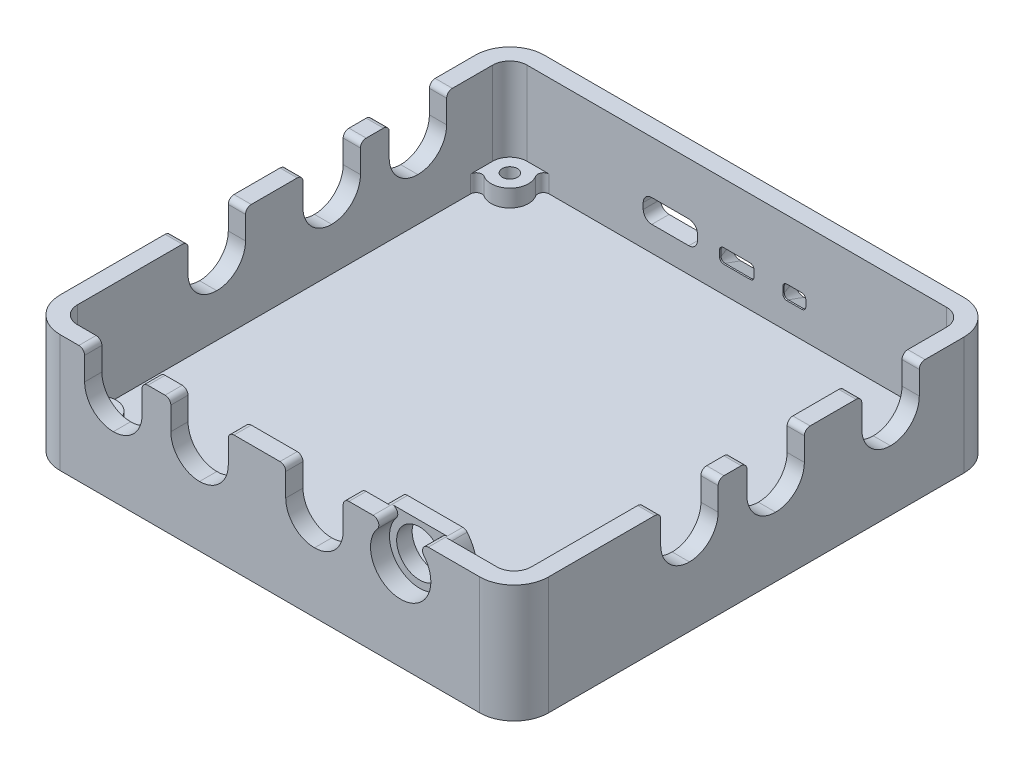
from build123d import *

# Parameters (mm, degrees)
SKETCH1_W           = 85
SKETCH1_H           = 84.25
BOSS_EXTRUDE1_DEPTH = 3
BOSS_EXTRUDE2_START = 3
SKETCH1_3_R         = 1.325
BOSS_EXTRUDE2_DEPTH = 3
BOSS_EXTRUDE6_START = 3
SKETCH1_5_W         = 85
SKETCH1_5_H         = 84.25
SKETCH1_5_W_2       = 79
SKETCH1_5_H_2       = 78.25
BOSS_EXTRUDE6_DEPTH = 17.5
FILLET1_R           = 3
FILLET2_R           = 6
FILLET3_START       = 2
FILLET3_DEPTH       = 4
SKETCH2_W           = 3
SKETCH2_H           = 10
SKETCH2_W_2         = 10
SKETCH2_H_2         = 3
CUT_EXTRUDE1_DEPTH  = 10
FILLET4_R           = 5
FILLET5_R           = 1
CUT_EXTRUDE2_REACH  = 98.564
SKETCH4_W           = 9.43
SKETCH4_H           = 4.04
FILLET6_R           = 1.5
CUT_EXTRUDE3_REACH  = 98.564
SKETCH5_W           = 6
SKETCH5_H           = 2.5
SKETCH5_W_2         = 4
FILLET7_R           = 0.7
CHAMFER1_SIZE       = 1
CHAMFER1_SIZE2      = 2.747477419
SKETCH6_R           = 4
BOSS_EXTRUDE7_DEPTH = 6
SKETCH6_4_R         = 4
CUT_EXTRUDE4_DEPTH  = 3.3
FILLET8_R           = 1


with BuildPart() as part:
    # Sketch1 → Boss-Extrude1 (new body)
    with BuildSketch(Plane(origin=(0, 0, 0), x_dir=(1, 0, 0), z_dir=(0, 1, 0))):
        Rectangle(SKETCH1_W, SKETCH1_H)
    extrude(amount=BOSS_EXTRUDE1_DEPTH)

    # Sketch1<3> → Boss-Extrude2 (add)
    # profile 1 of 4: a face of its own
    with BuildSketch(Plane(origin=(0, 0, 0), x_dir=(1, 0, 0), z_dir=(0, 1, 0)).offset(BOSS_EXTRUDE2_START)):
        with BuildLine():
            Line((36.25, -39.125), (39.5, -39.125))
            Line((39.5, -39.125), (39.5, -35.875))
            ThreePointArc((39.5, -35.875), (33.951902961, -33.576902961), (36.25, -39.125))
        make_face()
        with Locations(Location((36.25, -35.875, 0), (0, 0, 270))):
            Circle(SKETCH1_3_R, mode=Mode.SUBTRACT)
    # profile 2 of 4: a face of its own
    with BuildSketch(Plane(origin=(0, 0, 0), x_dir=(1, 0, 0), z_dir=(0, 1, 0)).offset(BOSS_EXTRUDE2_START)):
        with BuildLine():
            Line((-39.5, -39.125), (-36.25, -39.125))
            ThreePointArc((-36.25, -39.125), (-33.951902961, -33.576902961), (-39.5, -35.875))
            Line((-39.5, -35.875), (-39.5, -39.125))
        make_face()
        with Locations(Location((-36.25, -35.875, 0), (0, 0, 270))):
            Circle(SKETCH1_3_R, mode=Mode.SUBTRACT)
    # profile 3 of 4: a face of its own
    with BuildSketch(Plane(origin=(0, 0, 0), x_dir=(1, 0, 0), z_dir=(0, 1, 0)).offset(BOSS_EXTRUDE2_START)):
        with BuildLine():
            Line((39.5, 39.125), (36.25, 39.125))
            ThreePointArc((36.25, 39.125), (33.951902961, 33.576902961), (39.5, 35.875))
            Line((39.5, 35.875), (39.5, 39.125))
        make_face()
        with Locations(Location((36.25, 35.875, 0), (0, 0, 270))):
            Circle(SKETCH1_3_R, mode=Mode.SUBTRACT)
    # profile 4 of 4: a face of its own
    with BuildSketch(Plane(origin=(0, 0, 0), x_dir=(1, 0, 0), z_dir=(0, 1, 0)).offset(BOSS_EXTRUDE2_START)):
        with BuildLine():
            Line((-39.5, 39.125), (-39.5, 35.875))
            ThreePointArc((-39.5, 35.875), (-33.951902961, 33.576902961), (-36.25, 39.125))
            Line((-36.25, 39.125), (-39.5, 39.125))
        make_face()
        with Locations(Location((-36.25, 35.875, 0), (0, 0, 270))):
            Circle(SKETCH1_3_R, mode=Mode.SUBTRACT)
    extrude(amount=BOSS_EXTRUDE2_DEPTH)

    # Sketch1<5> → Boss-Extrude6 (add)
    with BuildSketch(Plane(origin=(0, 0, 0), x_dir=(1, 0, 0), z_dir=(0, 1, 0)).offset(BOSS_EXTRUDE6_START)):
        Rectangle(SKETCH1_5_W, SKETCH1_5_H)
        Rectangle(SKETCH1_5_W_2, SKETCH1_5_H_2, mode=Mode.SUBTRACT)
    extrude(amount=BOSS_EXTRUDE6_DEPTH)

    # Fillet1
    fillet1_edges = [part.edges().sort_by_distance(p)[0] for p in [
        (39.5, 13.25, -39.125),
        (-39.5, 13.25, -39.125),
        (-39.5, 13.25, 39.125),
        (39.5, 13.25, 39.125),
    ]]
    fillet(fillet1_edges, radius=FILLET1_R)

    # Fillet2
    fillet2_edges = [part.edges().sort_by_distance(p)[0] for p in [
        (42.5, 10.25, 42.125),
        (-42.5, 10.25, 42.125),
        (-42.5, 10.25, -42.125),
        (42.5, 10.25, -42.125),
    ]]
    fillet(fillet2_edges, radius=FILLET2_R)

    # Fillet3: read off the stored shape, not the designer's step
    # Fillet3 outline → Fillet3 (add)
    with BuildSketch(Plane(origin=(0, 0, 0), x_dir=(1, 0, 0), z_dir=(0, 1, 0)).offset(FILLET3_START)):
        with BuildLine():
            ThreePointArc((36.25, -39.125), (34.673518437, -38.717042555), (33.49281373, -37.595588235))
            ThreePointArc((33.49281373, -37.595588235), (33.518923357, -38.61007125), (32.644448725, -39.125))
            Line((32.644448725, -39.125), (36.25, -39.125))
        make_face()
        with BuildLine():
            ThreePointArc((39.5, -32.269448725), (38.98507125, -33.143923357), (37.970588235, -33.117813731))
            ThreePointArc((37.970588235, -33.117813731), (39.092042555, -34.298518437), (39.5, -35.875))
            Line((39.5, -35.875), (39.5, -32.269448725))
        make_face()
        with BuildLine():
            Line((-36.25, -39.125), (-32.644448725, -39.125))
            ThreePointArc((-32.644448725, -39.125), (-33.518923357, -38.61007125), (-33.492813731, -37.595588235))
            ThreePointArc((-33.492813731, -37.595588235), (-34.673518437, -38.717042555), (-36.25, -39.125))
        make_face()
        with BuildLine():
            ThreePointArc((37.970588235, 33.117813731), (38.98507125, 33.143923357), (39.5, 32.269448725))
            Line((39.5, 32.269448725), (39.5, 35.875))
            ThreePointArc((39.5, 35.875), (39.092042555, 34.298518437), (37.970588235, 33.117813731))
        make_face()
        with BuildLine():
            ThreePointArc((-39.5, -35.875), (-39.092042555, -34.298518437), (-37.970588235, -33.11781373))
            ThreePointArc((-37.970588235, -33.11781373), (-38.98507125, -33.143923357), (-39.5, -32.269448725))
            Line((-39.5, -32.269448725), (-39.5, -35.875))
        make_face()
        with BuildLine():
            ThreePointArc((32.644448725, 39.125), (33.518923357, 38.61007125), (33.492813731, 37.595588235))
            ThreePointArc((33.492813731, 37.595588235), (34.673518437, 38.717042555), (36.25, 39.125))
            Line((36.25, 39.125), (32.644448725, 39.125))
        make_face()
        with BuildLine():
            Line((-39.5, 35.875), (-39.5, 32.269448725))
            ThreePointArc((-39.5, 32.269448725), (-38.98507125, 33.143923357), (-37.970588235, 33.117813731))
            ThreePointArc((-37.970588235, 33.117813731), (-39.092042555, 34.298518437), (-39.5, 35.875))
        make_face()
        with BuildLine():
            ThreePointArc((-33.492813731, 37.595588235), (-33.518923357, 38.61007125), (-32.644448725, 39.125))
            Line((-32.644448725, 39.125), (-36.25, 39.125))
            ThreePointArc((-36.25, 39.125), (-34.673518437, 38.717042555), (-33.492813731, 37.595588235))
        make_face()
    extrude(amount=FILLET3_DEPTH)

    # Sketch2 → Cut-Extrude1 (cut)
    with BuildSketch(Plane(origin=(0, 20.5, 0), x_dir=(1, 0, 0), z_dir=(0, 1, 0))):
        with Locations((-41, 23.125)):
            Rectangle(SKETCH2_W, SKETCH2_H)
        with Locations((-41, 8.125)):
            Rectangle(SKETCH2_W, SKETCH2_H)
        with Locations((-41, -11.875)):
            Rectangle(SKETCH2_W, SKETCH2_H)
        with Locations((-27.25, -40.625)):
            Rectangle(SKETCH2_W_2, SKETCH2_H_2)
        with Locations((-12.25, -40.625)):
            Rectangle(SKETCH2_W_2, SKETCH2_H_2)
        with Locations((7.75, -40.625)):
            Rectangle(SKETCH2_W_2, SKETCH2_H_2)
        with Locations((41, 23.375)):
            Rectangle(SKETCH2_W, SKETCH2_H)
        with Locations((41, 3.375)):
            Rectangle(SKETCH2_W, SKETCH2_H)
        with Locations((41, -11.625)):
            Rectangle(SKETCH2_W, SKETCH2_H)
    extrude(amount=-CUT_EXTRUDE1_DEPTH, mode=Mode.SUBTRACT)

    # Fillet4
    fillet4_edges = [part.edges().sort_by_distance(p)[0] for p in [
        (41, 10.5, 6.625),
        (41, 10.5, 16.625),
        (41, 10.5, -8.375),
        (41, 10.5, 1.625),
        (41, 10.5, -28.375),
        (41, 10.5, -18.375),
        (2.75, 10.5, 40.625),
        (12.75, 10.5, 40.625),
        (-17.25, 10.5, 40.625),
        (-7.25, 10.5, 40.625),
        (-32.25, 10.5, 40.625),
        (-22.25, 10.5, 40.625),
        (-41, 10.5, 16.875),
        (-41, 10.5, 6.875),
        (-41, 10.5, -3.125),
        (-41, 10.5, -18.125),
        (-41, 10.5, -13.125),
        (-41, 10.5, -28.125),
    ]]
    fillet(fillet4_edges, radius=FILLET4_R - 0.0001)  # a hair under: the kernel refuses the full size

    # Fillet5
    fillet5_edges = [part.edges().sort_by_distance(p)[0] for p in [
        (12.75, 20.5, 40.625),
        (2.75, 20.5, 40.625),
        (41, 20.5, -18.375),
        (41, 20.5, -28.375),
        (41, 20.5, 1.625),
        (41, 20.5, -8.375),
        (41, 20.5, 16.625),
        (41, 20.5, 6.625),
        (-7.25, 20.5, 40.625),
        (-17.25, 20.5, 40.625),
        (-22.25, 20.5, 40.625),
        (-32.25, 20.5, 40.625),
        (-41, 20.5, 6.875),
        (-41, 20.5, 16.875),
        (-41, 20.5, -13.125),
        (-41, 20.5, -3.125),
        (-41, 20.5, -28.125),
        (-41, 20.5, -18.125),
    ]]
    fillet(fillet5_edges, radius=FILLET5_R)

    # Sketch4 → Cut-Extrude2 (cut, up to next)
    with BuildSketch(Plane(origin=(0, 0, -42.125), x_dir=(-1, 0, 0), z_dir=(0, 0, -1)), mode=Mode.PRIVATE) as cut_extrude2_sk1:
        with Locations((11.575, 9.37)):
            Rectangle(SKETCH4_W, SKETCH4_H)
    cut_extrude2_tool1 = extrude(cut_extrude2_sk1.sketch, amount=-CUT_EXTRUDE2_REACH, mode=Mode.PRIVATE) & part.part
    add(cut_extrude2_tool1.solids().sort_by_distance((-11.575, 9.37, -42.125))[0], mode=Mode.SUBTRACT)

    # Fillet6
    fillet6_edges = [part.edges().sort_by_distance(p)[0] for p in [
        (-16.29, 7.35, -40.625),
        (-6.86, 7.35, -40.625),
        (-6.86, 11.39, -40.625),
        (-16.29, 11.39, -40.625),
    ]]
    fillet(fillet6_edges, radius=FILLET6_R)

    # Sketch5 → Cut-Extrude3 (cut, up to next)
    with BuildSketch(Plane(origin=(0, 0, -42.125), x_dir=(-1, 0, 0), z_dir=(0, 0, -1)), mode=Mode.PRIVATE) as cut_extrude3_sk1:
        with Locations((0, 8.85)):
            Rectangle(SKETCH5_W, SKETCH5_H)
    cut_extrude3_tool1 = extrude(cut_extrude3_sk1.sketch, amount=-CUT_EXTRUDE3_REACH, mode=Mode.PRIVATE) & part.part
    # Sketch5 → Cut-Extrude3 (cut, up to next)
    with BuildSketch(Plane(origin=(0, 0, -42.125), x_dir=(-1, 0, 0), z_dir=(0, 0, -1)), mode=Mode.PRIVATE) as cut_extrude3_sk2:
        with Locations((-10, 8.85)):
            Rectangle(SKETCH5_W_2, SKETCH5_H)
    cut_extrude3_tool2 = extrude(cut_extrude3_sk2.sketch, amount=-CUT_EXTRUDE3_REACH, mode=Mode.PRIVATE) & part.part
    add(cut_extrude3_tool1.solids().sort_by_distance((0, 8.85, -42.125))[0], mode=Mode.SUBTRACT)
    add(cut_extrude3_tool2.solids().sort_by_distance((10, 8.85, -42.125))[0], mode=Mode.SUBTRACT)

    # Fillet7
    fillet7_edges = [part.edges().sort_by_distance(p)[0] for p in [
        (3, 7.6, -40.625),
        (3, 10.1, -40.625),
        (-3, 10.1, -40.625),
        (-3, 7.6, -40.625),
        (8, 10.1, -40.625),
        (8, 7.6, -40.625),
        (12, 7.6, -40.625),
        (12, 10.1, -40.625),
    ]]
    fillet(fillet7_edges, radius=FILLET7_R)

    # Chamfer1
    chamfer1_edges = [part.edges().sort_by_distance(p)[0] for p in [
        (10, 7.6, -42.125),
        (12, 8.85, -42.125),
        (10, 10.1, -42.125),
        (8, 8.85, -42.125),
        (0, 10.1, -42.125),
        (-3, 8.85, -42.125),
        (0, 7.6, -42.125),
        (3, 8.85, -42.125),
        (11.794974747, 7.805025253, -42.125),
        (11.794974747, 9.894974747, -42.125),
        (8.205025253, 9.894974747, -42.125),
        (8.205025253, 7.805025253, -42.125),
        (-2.794974747, 9.894974747, -42.125),
        (2.794974747, 7.805025253, -42.125),
        (2.794974747, 9.894974747, -42.125),
        (-2.794974747, 7.805025253, -42.125),
    ]]
    chamfer1_side = [part.faces().sort_by_distance(p)[0] for p in [
        (0.224781129, 10.2957104, -42.125),
    ]]
    chamfer(chamfer1_edges, length=CHAMFER1_SIZE, length2=CHAMFER1_SIZE2, reference=chamfer1_side[0])

    # Sketch6 → Boss-Extrude7 (add)
    # profile 1 of 2: a face of its own
    with BuildSketch(Plane.XY.offset(42.125)):
        with BuildLine():
            ThreePointArc((24.350781059, 20.5), (26.99067215, 18.595028226), (28, 15.5))
            ThreePointArc((28, 15.5), (19.654971774, 11.25932785), (21.149218941, 20.5))
            Line((21.149218941, 20.5), (17.5, 20.5))
            ThreePointArc((17.5, 20.5), (20.057417596, 8.768543991), (30, 15.5))
            ThreePointArc((30, 15.5), (29.481456009, 18.192582404), (28, 20.5))
            Line((28, 20.5), (24.350781059, 20.5))
        make_face()
    # profile 2 of 2: a face of its own
    with BuildSketch(Plane.XY.offset(42.125)):
        with BuildLine():
            ThreePointArc((21.149218941, 20.5), (19.654971774, 11.25932785), (28, 15.5))
            ThreePointArc((28, 15.5), (26.99067215, 18.595028226), (24.350781059, 20.5))
            Line((24.350781059, 20.5), (21.149218941, 20.5))
        make_face()
        with Locations((22.75, 15.5)):
            Circle(SKETCH6_R, mode=Mode.SUBTRACT)
    extrude(amount=-BOSS_EXTRUDE7_DEPTH)

    # Sketch6<4> → Cut-Extrude4 (cut)
    # profile 1 of 2: a face of its own
    with BuildSketch(Plane.XY.offset(42.125)):
        with BuildLine():
            ThreePointArc((21.149218941, 20.5), (19.654971774, 11.25932785), (28, 15.5))
            ThreePointArc((28, 15.5), (26.99067215, 18.595028226), (24.350781059, 20.5))
            Line((24.350781059, 20.5), (21.149218941, 20.5))
        make_face()
        with Locations((22.75, 15.5)):
            Circle(SKETCH6_4_R, mode=Mode.SUBTRACT)
    # profile 2 of 2: a face of its own
    with BuildSketch(Plane.XY.offset(42.125)):
        with Locations((22.75, 15.5)):
            Circle(SKETCH6_4_R)
    extrude(amount=-CUT_EXTRUDE4_DEPTH, mode=Mode.SUBTRACT)

    # Fillet8
    fillet8_edges = [part.edges().sort_by_distance(p)[0] for p in [
        (17.5, 20.5, 37.625),
        (28, 20.5, 37.625),
        (21.149218941, 20.5, 40.475),
        (24.350781059, 20.5, 40.475),
    ]]
    fillet(fillet8_edges, radius=FILLET8_R - 0.0001)  # a hair under: the kernel refuses the full size


solid = part.part
